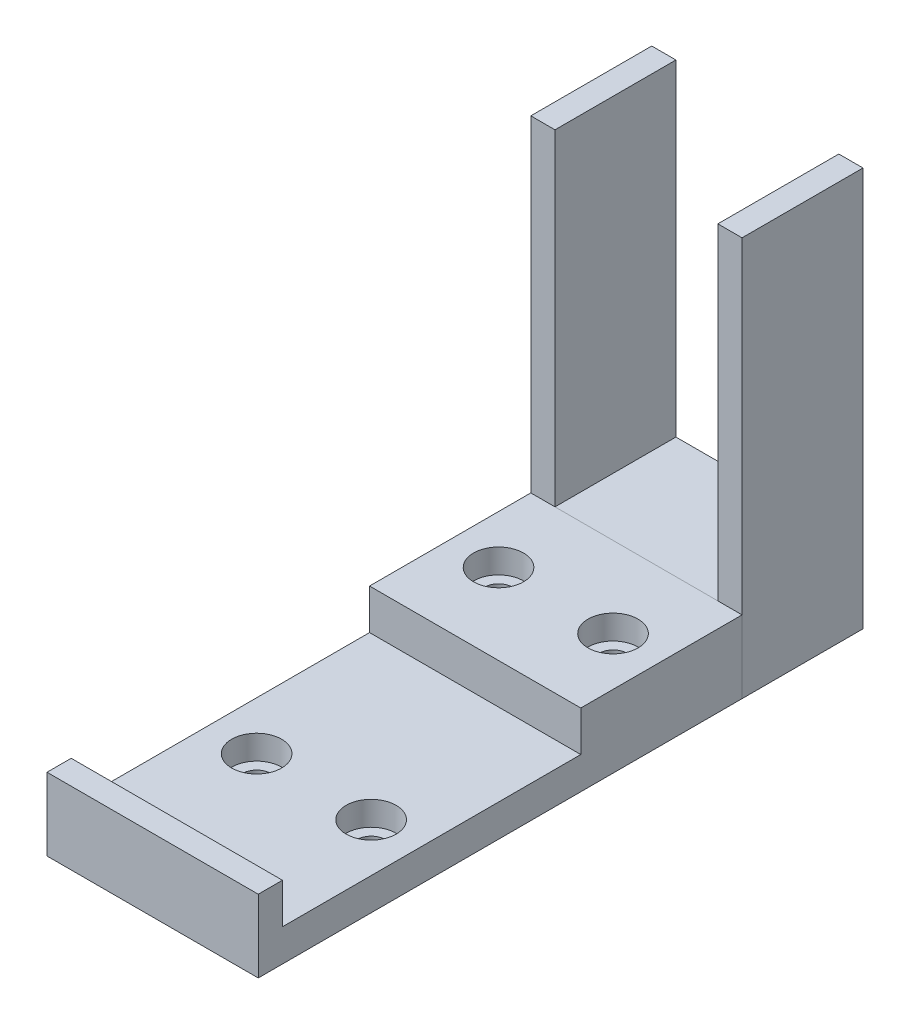
from build123d import *

# Parameters (mm, degrees)
SALIENTE_EXTRUIR1_DEPTH = 15
CROQUIS3_R              = 1.75
CORTAR_EXTRUIR1_DEPTH   = 12
CORTAR_EXTRUIR2_DEPTH   = 3.2
CROQUIS6_W              = 26.2
CROQUIS6_H              = 9
SALIENTE_EXTRUIR2_DEPTH = 20
CROQUIS8_W              = 26.2
CROQUIS8_H              = 4
SALIENTE_EXTRUIR4_DEPTH = 40
CROQUIS9_W              = 26.2
CROQUIS9_H              = 3
SALIENTE_EXTRUIR5_DEPTH = 5
CROQUIS10_R             = 1.75
CORTAR_EXTRUIR3_DEPTH   = 87.237230939
CROQUIS11_R             = 3.1
CORTAR_EXTRUIR4_DEPTH   = 3
CROQUIS12_R             = 3.1
CORTAR_EXTRUIR5_DEPTH   = 3


with BuildPart() as part:
    # Croquis1 → Saliente-Extruir1 (new body)
    with BuildSketch(Plane.XY):
        Polygon((-13.1, 20.25), (-10.1, 20.25), (-10.1, -20.25), (10.1, -20.25), (10.1, 20.25), (13.1, 20.25), (13.1, -29.25), (-13.1, -29.25), align=None)
    extrude(amount=SALIENTE_EXTRUIR1_DEPTH)

    # Croquis3 → Cortar-Extruir1 (cut)
    with BuildSketch(Plane(origin=(0, 0, 0), x_dir=(-1, 0, 0), z_dir=(0, 0, -1))):
        with Locations((4.7, 25.25)):
            Circle(CROQUIS3_R)
        with Locations((-4.7, 25.25)):
            Circle(CROQUIS3_R)
        with Locations((4.7, -24.75)):
            Circle(CROQUIS3_R)
        with Locations((-4.7, -24.75)):
            Circle(CROQUIS3_R)
    extrude(amount=-CORTAR_EXTRUIR1_DEPTH, mode=Mode.SUBTRACT)

    # Croquis4 → Cortar-Extruir2 (cut)
    with BuildSketch(Plane(origin=(0, 0, 7), x_dir=(-1, 0, 0), z_dir=(0, 0, -1))):
        with BuildLine():
            Line((7.8, -24.75), (7.8, -29.25))
            Line((7.8, -29.25), (1.6, -29.25))
            Line((1.6, -29.25), (1.6, -24.75))
            ThreePointArc((1.6, -24.75), (4.7, -21.65), (7.8, -24.75))
        make_face()
        with BuildLine():
            Line((-1.6, -24.75), (-1.6, -29.25))
            Line((-1.6, -29.25), (-7.8, -29.25))
            Line((-7.8, -29.25), (-7.8, -24.75))
            ThreePointArc((-7.8, -24.75), (-4.7, -21.65), (-1.6, -24.75))
        make_face()
    extrude(amount=-CORTAR_EXTRUIR2_DEPTH, mode=Mode.SUBTRACT)

    # Croquis6 → Saliente-Extruir2 (add)
    with BuildSketch(Plane.XY.offset(15)):
        with Locations((0, -24.75)):
            Rectangle(CROQUIS6_W, CROQUIS6_H)
    extrude(amount=SALIENTE_EXTRUIR2_DEPTH)

    # Croquis8 → Saliente-Extruir4 (add)
    with BuildSketch(Plane.XY.offset(35)):
        with Locations((0, -27.25)):
            Rectangle(CROQUIS8_W, CROQUIS8_H)
    extrude(amount=SALIENTE_EXTRUIR4_DEPTH)

    # Croquis9 → Saliente-Extruir5 (add)
    with BuildSketch(Plane(origin=(0, -25.25, 0), x_dir=(1, 0, 0), z_dir=(0, 1, 0))):
        with Locations((0, -73.5)):
            Rectangle(CROQUIS9_W, CROQUIS9_H)
    extrude(amount=SALIENTE_EXTRUIR5_DEPTH)

    # Croquis10 → Cortar-Extruir3 (cut, through all)
    with BuildSketch(Plane(origin=(0, -20.25, 0), x_dir=(1, 0, 0), z_dir=(0, 1, 0))):
        with Locations((-7.1, -25)):
            Circle(CROQUIS10_R)
        with Locations((7.1, -25)):
            Circle(CROQUIS10_R)
        with Locations((-7.1, -55)):
            Circle(CROQUIS10_R)
        with Locations((7.1, -55)):
            Circle(CROQUIS10_R)
    extrude(amount=-CORTAR_EXTRUIR3_DEPTH, mode=Mode.SUBTRACT)

    # Croquis11 → Cortar-Extruir4 (cut)
    with BuildSketch(Plane(origin=(0, -20.25, 0), x_dir=(1, 0, 0), z_dir=(0, 1, 0))):
        with Locations((-7.1, -25)):
            Circle(CROQUIS11_R)
        with Locations((7.1, -25)):
            Circle(CROQUIS11_R)
    extrude(amount=-CORTAR_EXTRUIR4_DEPTH, mode=Mode.SUBTRACT)

    # Croquis12 → Cortar-Extruir5 (cut)
    with BuildSketch(Plane(origin=(0, -25.25, 0), x_dir=(1, 0, 0), z_dir=(0, 1, 0))):
        with Locations((-7.1, -55)):
            Circle(CROQUIS12_R)
        with Locations((7.1, -55)):
            Circle(CROQUIS12_R)
    extrude(amount=-CORTAR_EXTRUIR5_DEPTH, mode=Mode.SUBTRACT)


with BuildPart() as body_2:
    # Partir1: the piece on the far side of the plane
    add(part.part)
    split(bisect_by=Plane.XY.offset(15), keep=Keep.BOTTOM)


with BuildPart() as part_1:
    add(part.part)

    # Partir1
    split(bisect_by=Plane.XY.offset(15), keep=Keep.TOP)


solid = Compound([body_2.part, part_1.part])
